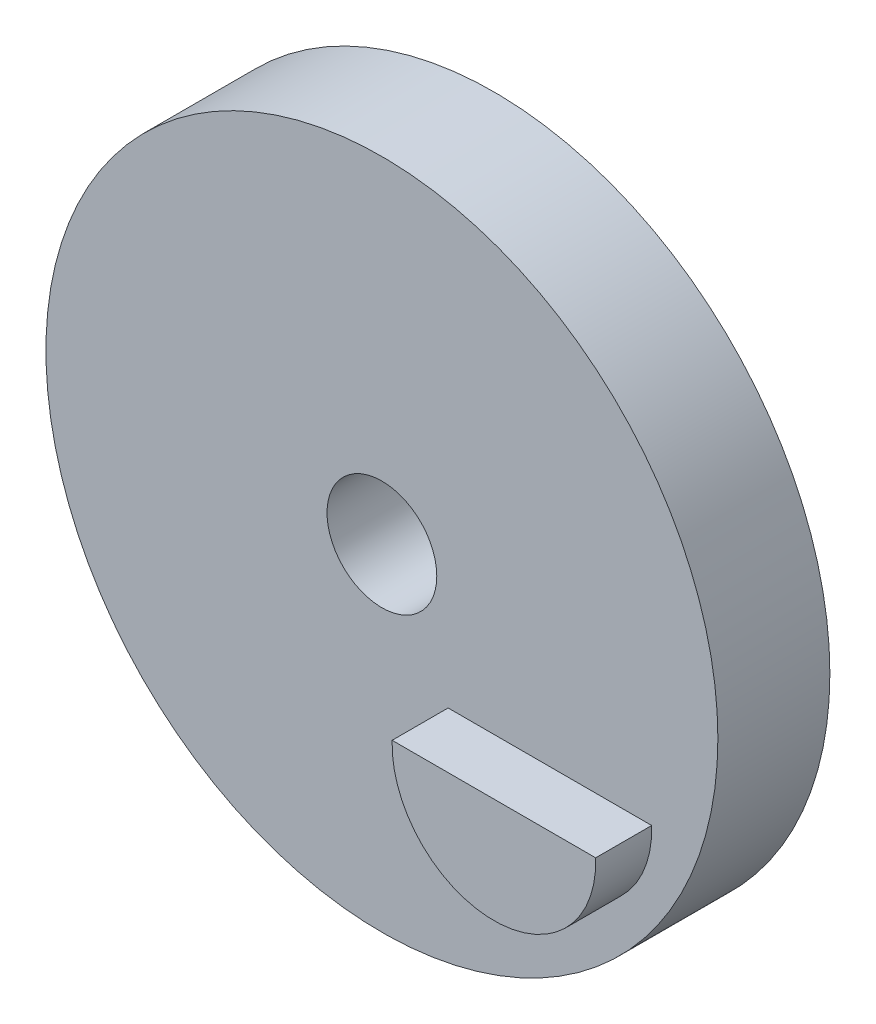
from build123d import *

# Parameters (mm, degrees)
SKETCH1_R           = 38.1
SKETCH1_R_2         = 6.223
BOSS_EXTRUDE1_DEPTH = 12.7
BOSS_EXTRUDE2_DEPTH = 19.05


with BuildPart() as part:
    # Sketch1 → Boss-Extrude1 (new body)
    with BuildSketch(Plane.XY):
        Circle(SKETCH1_R)
        Circle(SKETCH1_R_2, mode=Mode.SUBTRACT)
    extrude(amount=BOSS_EXTRUDE1_DEPTH)

    # Sketch2 → Boss-Extrude2 (add)
    with BuildSketch(Plane.XY):
        with BuildLine():
            Line((7.509692341, -12.308305384), (30.590307659, -12.308305384))
            ThreePointArc((30.590307659, -12.308305384), (19.05, -24.246953085), (7.509692341, -12.308305384))
        make_face()
    extrude(amount=BOSS_EXTRUDE2_DEPTH)


solid = part.part
